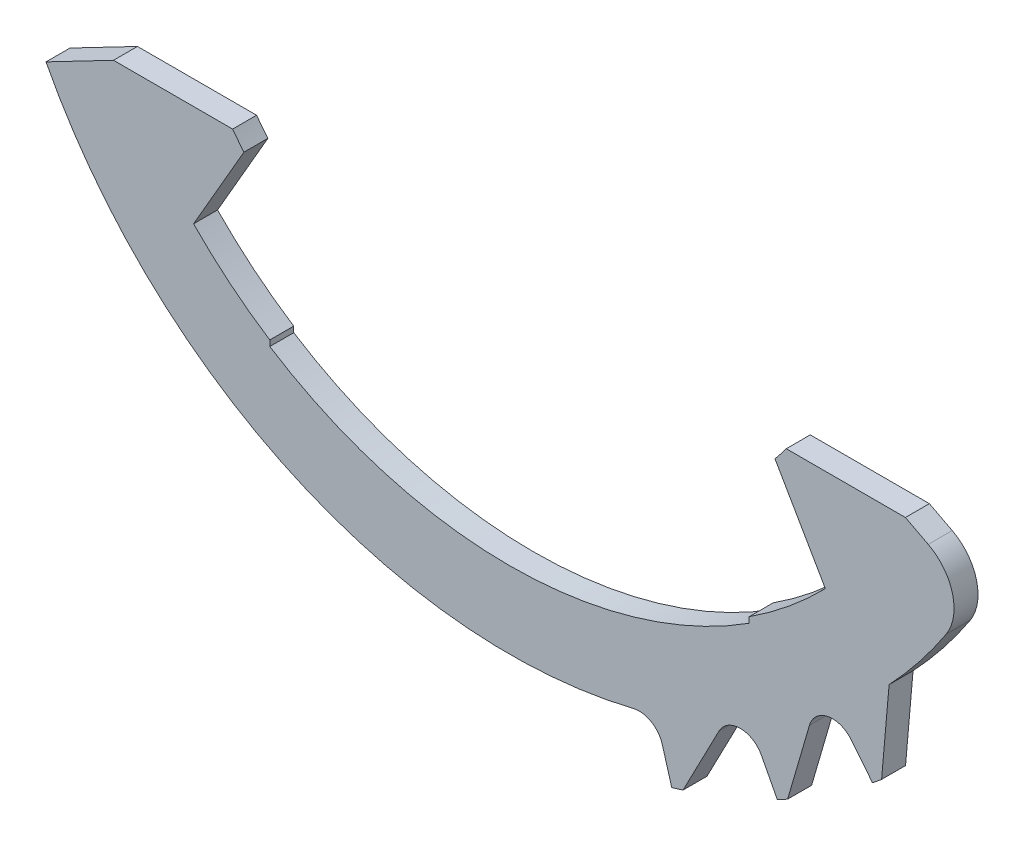
from build123d import *

# Parameters (mm, degrees)
OTHER_10076_5_DEPTH = 0.5
CUT_EXTRUDE1_START  = -0.5
CUT_EXTRUDE1_DEPTH  = 0.5


# Read off the part's stored shape, not the designer's step: 10076-5
with BuildPart() as part:
    # Other 10076-5 outline → Other 10076-5 (new body)
    with BuildSketch(Plane.XY):
        with BuildLine():
            ThreePointArc((7.573674013, -9.436602245), (7.668819519, -9.359444812), (7.763179028, -9.281328104))
            Line((7.763179028, -9.281328104), (7.919995926, -7.488902759))
            ThreePointArc((7.919995926, -7.488902759), (8.548470738, -6.76266575), (9.110578105, -5.983925684))
            ThreePointArc((9.110578105, -5.983925684), (9.242448569, -5.182849851), (8.736493865, -4.547930843))
            Line((8.736493865, -4.547930843), (8.260223146, -4.3))
            Line((8.260223146, -4.3), (5.774945887, -4.3))
            ThreePointArc((5.774945887, -4.3), (5.659072475, -4.451392897), (5.53923133, -4.5996648))
            Line((5.53923133, -4.5996648), (6.59, -6.419649523))
            ThreePointArc((6.59, -6.419649523), (5.831509763, -7.1157216), (5, -7.722693831))
            Line((5, -7.722693831), (5, -7.841555968))
            ThreePointArc((5, -7.841555968), (0, -9.3), (-5, -7.841555968))
            Line((-5, -7.841555968), (-5, -7.722693831))
            ThreePointArc((-5, -7.722693831), (-5.831509763, -7.1157216), (-6.59, -6.419649523))
            Line((-6.59, -6.419649523), (-5.53923133, -4.5996648))
            ThreePointArc((-5.53923133, -4.5996648), (-5.659072475, -4.451392897), (-5.774945887, -4.3))
            Line((-5.774945887, -4.3), (-8.260223146, -4.3))
            Line((-8.260223146, -4.3), (-10.732831081, -5.58715822))
            ThreePointArc((-10.732831081, -5.58715822), (-10.675718173, -5.6955282), (-10.617511084, -5.803314431))
            Line((-10.617511084, -5.803314431), (-9.055174855, -6.258693914))
            ThreePointArc((-9.055174855, -6.258693914), (-8.704696722, -6.64117368), (-8.882127626, -7.128661083))
            Line((-8.882127626, -7.128661083), (-9.436602245, -7.573674013))
            ThreePointArc((-9.436602245, -7.573674013), (-9.359444812, -7.668819519), (-9.281328104, -7.763179028))
            Line((-9.281328104, -7.763179028), (-7.660171598, -7.905011844))
            ThreePointArc((-7.660171598, -7.905011844), (-7.241809703, -8.211767477), (-7.320727248, -8.724502998))
            Line((-7.320727248, -8.724502998), (-7.777730077, -9.269137762))
            ThreePointArc((-7.777730077, -9.269137762), (-7.683493234, -9.347402405), (-7.588468891, -9.424709008))
            Line((-7.588468891, -9.424709008), (-5.970792243, -9.247544602))
            ThreePointArc((-5.970792243, -9.247544602), (-5.500623999, -9.466787654), (-5.477995427, -9.985067155))
            Line((-5.477995427, -9.985067155), (-5.819964104, -10.608393744))
            ThreePointArc((-5.819964104, -10.608393744), (-5.712269322, -10.666769858), (-5.603989074, -10.724052707))
            Line((-5.603989074, -10.724052707), (-4.05195869, -10.234699407))
            ThreePointArc((-4.05195869, -10.234699407), (-3.548052399, -10.358004491), (-3.424747314, -10.861910782))
            Line((-3.424747314, -10.861910782), (-3.638540174, -11.539975104))
            ThreePointArc((-3.638540174, -11.539975104), (-3.521526102, -11.576219327), (-3.404151099, -11.611277074))
            Line((-3.404151099, -11.611277074), (-1.977410637, -10.828540453))
            ThreePointArc((-1.977410637, -10.828540453), (-1.459131136, -10.851169025), (-1.239888083, -11.321337268))
            Line((-1.239888083, -11.321337268), (-1.317289186, -12.028081692))
            ThreePointArc((-1.317289186, -12.028081692), (-1.195452609, -12.04080118), (-1.073493507, -12.052286575))
            Line((-1.073493507, -12.052286575), (0.173128198, -11.006246762))
            ThreePointArc((0.173128198, -11.006246762), (0.685863719, -10.927329218), (0.992619352, -11.345691113))
            Line((0.992619352, -11.345691113), (1.054584487, -12.053955847))
            ThreePointArc((1.054584487, -12.053955847), (1.176561457, -12.042661796), (1.298417839, -12.030133462))
            Line((1.298417839, -12.030133462), (2.317013814, -10.760989181))
            ThreePointArc((2.317013814, -10.760989181), (2.804501216, -10.583558277), (3.186980982, -10.93403641))
            Line((3.186980982, -10.93403641), (3.38593107, -11.616603238))
            ThreePointArc((3.38593107, -11.616603238), (3.503360927, -11.581729673), (3.620431715, -11.545669067))
            Line((3.620431715, -11.545669067), (4.371857887, -10.10219282))
            ThreePointArc((4.371857887, -10.10219282), (4.815363304, -9.833067127), (5.258868721, -10.10219282))
            Line((5.258868721, -10.10219282), (5.58715822, -10.732831081))
            ThreePointArc((5.58715822, -10.732831081), (5.6955282, -10.675718173), (5.803314431, -10.617511084))
            Line((5.803314431, -10.617511084), (6.258693914, -9.055174855))
            ThreePointArc((6.258693914, -9.055174855), (6.64117368, -8.704696722), (7.128661083, -8.882127626))
            Line((7.128661083, -8.882127626), (7.573674013, -9.436602245))
        make_face()
    extrude(amount=OTHER_10076_5_DEPTH)

    # Sketch1 → Cut-Extrude1 (cut)
    with BuildSketch(Plane.XY.offset(0.5).offset(CUT_EXTRUDE1_START)):
        with BuildLine():
            Line((-9.668418082, -5.033059884), (-10.732831081, -5.58715822))
            ThreePointArc((-10.732831081, -5.58715822), (-5.712269321, -10.666769858), (1.298417839, -12.030133462))
            Line((1.298417839, -12.030133462), (2.317013814, -10.760989181))
            ThreePointArc((2.317013814, -10.760989181), (2.43835696, -10.652222893), (2.588229912, -10.588251316))
            ThreePointArc((2.588229912, -10.588251316), (-4.499700444, -9.927874693), (-9.668418082, -5.033059884))
        make_face()
    extrude(amount=CUT_EXTRUDE1_DEPTH, mode=Mode.SUBTRACT)


solid = part.part
